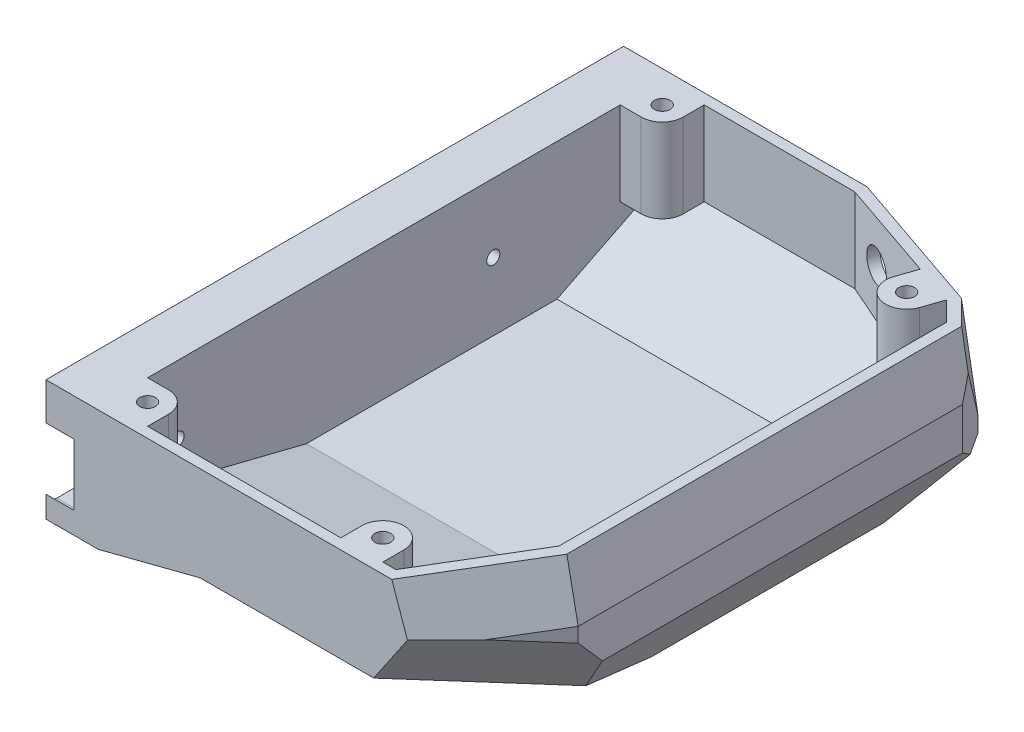
from build123d import *
from OCP.BRepFilletAPI import BRepFilletAPI_MakeChamfer

# Parameters (mm, degrees)
SKETCH1_W               = 55
SKETCH1_H               = 60
BOSS_EXTRUDE1_DEPTH     = 28
CHAMFER5_SIZE           = 15
CHAMFER5_SIZE2          = 9
CUT_EXTRUDE3_DEPTH      = 98.816154085
CUT_EXTRUDE5_DEPTH      = 98.816154085
CHAMFER2_SIZE           = 6
CHAMFER2_SIZE2          = 10
CHAMFER2_PART_2_SIZE    = 6
CHAMFER2_PART_2_SIZE2   = 10
CHAMFER3_SIZE           = 10
CHAMFER3_SIZE2          = 3
CHAMFER8_SIZE           = 3
CHAMFER8_SIZE2          = 4.688384964
CHAMFER8_SIZE2_2        = 4.826086957
SHELL1_T                = -2
SKETCH1_3_W             = 9.35
SKETCH1_3_H             = 100
SKETCH1_3_H_2           = 10
BOSS_EXTRUDE2_DEPTH     = 28
CUT_EXTRUDE1_DEPTH      = 5.3
CUT_EXTRUDE_THIN1_DEPTH = 5.3
SKETCH4_R               = 1.250001298
SKETCH4_R_2             = 1.250245712
CUT_EXTRUDE2_DEPTH      = 4.05
CUT_EXTRUDE4_DEPTH      = 9.35
CUT_EXTRUDE6_DEPTH      = 98.816154085
CHAMFER6_SIZE           = 20
CHAMFER6_SIZE_2         = 5
SKETCH10_R              = 3
CUT_EXTRUDE7_DEPTH      = 2
SKETCH12_R              = 1.5
BOSS_EXTRUDE3_DEPTH     = 18.45
SKETCH12_4_R            = 1.5
BOSS_EXTRUDE4_DEPTH     = 15.973931
SKETCH12_5_R            = 1.5
BOSS_EXTRUDE5_DEPTH     = 17.86762


with BuildPart() as part:
    # Sketch1 → Boss-Extrude1 (new body)
    # profile 1 of 2: a face of its own
    with BuildSketch(Plane(origin=(0, 0, 0), x_dir=(1, 0, 0), z_dir=(0, 1, 0))):
        Polygon((29.5, 50), (-7.5, 50), (-42.5, 38), (-42.5, -40), (-30.5, -60), (29.5, -60), (29.5, -50), align=None)
        Rectangle(SKETCH1_W, SKETCH1_H, mode=Mode.SUBTRACT)
    # profile 2 of 2: a face of its own
    with BuildSketch(Plane(origin=(0, 0, 0), x_dir=(1, 0, 0), z_dir=(0, 1, 0))):
        Rectangle(SKETCH1_W, SKETCH1_H)
    extrude(amount=BOSS_EXTRUDE1_DEPTH)

    # Chamfer5
    chamfer5_edges = [part.edges().sort_by_distance(p)[0] for p in [
        (-25, 0, -44),
    ]]
    chamfer5_side = [part.faces().sort_by_distance(p)[0] for p in [
        (-5.320816864, 0, 5.646903821),
    ]]
    chamfer(chamfer5_edges, length=CHAMFER5_SIZE, length2=CHAMFER5_SIZE2, reference=chamfer5_side[0])

    # Sketch6 → Cut-Extrude3 (cut, through all)
    with BuildSketch(Plane(origin=(29.5, 0, 0), x_dir=(0, 0, -1), z_dir=(1, 0, 0))):
        Polygon((28.599998808, 0.090000199), (38.599998808, 5.090000199), (50, 10.790000795), (50, 0), (28.41999841, 0), align=None)
    extrude(amount=-CUT_EXTRUDE3_DEPTH, mode=Mode.SUBTRACT)

    # Sketch8 → Cut-Extrude5 (cut, through all)
    with BuildSketch(Plane.ZY.offset(42.5)):
        Polygon((20, 0), (60, 10), (60, 0), align=None)
    extrude(amount=-CUT_EXTRUDE5_DEPTH, mode=Mode.SUBTRACT)

    # Chamfer2
    chamfer2_edges = [part.edges().sort_by_distance(p)[0] for p in [
        (-42.5, 0, -1.071428571),
    ]]
    chamfer2_side = [part.faces().sort_by_distance(p)[0] for p in [
        (-5.998960327, 0, -3.839335876),
    ]]
    chamfer(chamfer2_edges, length=CHAMFER2_SIZE, length2=CHAMFER2_SIZE2, reference=chamfer2_side[0])

    # Chamfer2 part 2
    chamfer2_part_2_edges = [part.edges().sort_by_distance(p)[0] for p in [
        (-36.5, 7.5, 50),
    ]]
    chamfer2_part_2_side = [part.faces().sort_by_distance(p)[0] for p in [
        (-5.108695652, 4.855072464, 39.420289855),
    ]]
    chamfer(chamfer2_part_2_edges, length=CHAMFER2_PART_2_SIZE, length2=CHAMFER2_PART_2_SIZE2, reference=chamfer2_part_2_side[0])

    # Chamfer3: one chamfer whose edges measure the first distance from different faces: ONE call of the kernel's chamfer builder (chamfer() names one face for all edges)
    chamfer3_edges_1 = [part.edges().sort_by_distance(p)[0] for p in [
        (-36.5, 28, 50),
    ]]
    chamfer3_side_1 = [part.faces().sort_by_distance(p)[0] for p in [
        (-36.986722145, 22.762198781, 49.188796426),
    ]]
    chamfer3_edges_2 = [part.edges().sort_by_distance(p)[0] for p in [
        (-42.5, 28, 1),
    ]]
    chamfer3_side_2 = [part.faces().sort_by_distance(p)[0] for p in [
        (-42.5, 19.062821539, 0.675718674),
    ]]
    chamfer3 = BRepFilletAPI_MakeChamfer(part.part.solid().wrapped)
    for e in chamfer3_edges_1:
        chamfer3.Add(CHAMFER3_SIZE, CHAMFER3_SIZE2, e.wrapped, chamfer3_side_1[0].wrapped)  # the first distance lies on this face
    for e in chamfer3_edges_2:
        chamfer3.Add(CHAMFER3_SIZE, CHAMFER3_SIZE2, e.wrapped, chamfer3_side_2[0].wrapped)  # the first distance lies on this face
    add(Compound.cast(chamfer3.Shape()), mode=Mode.REPLACE)

    # Chamfer8: one chamfer whose edges measure the first distance from different faces: ONE call of the kernel's chamfer builder (chamfer() names one face for all edges)
    chamfer8_edges_1 = [part.edges().sort_by_distance(p)[0] for p in [
        (-41, 23, -38.514285714),
    ]]
    chamfer8_side_1 = [part.faces().sort_by_distance(p)[0] for p in [
        (-40.999367405, 23.002108649, 0.534923115),
    ]]
    chamfer8_edges_2 = [part.edges().sort_by_distance(p)[0] for p in [
        (-42.5, 14, -38),
    ]]
    chamfer8_side_2 = [part.faces().sort_by_distance(p)[0] for p in [
        (-24.809989525, 18.489778037, -44.065146449),
    ]]
    chamfer8 = BRepFilletAPI_MakeChamfer(part.part.solid().wrapped)
    for e in chamfer8_edges_1:
        chamfer8.Add(CHAMFER8_SIZE, CHAMFER8_SIZE2, e.wrapped, chamfer8_side_1[0].wrapped)  # the first distance lies on this face
    for e in chamfer8_edges_2:
        chamfer8.Add(CHAMFER8_SIZE, CHAMFER8_SIZE2_2, e.wrapped, chamfer8_side_2[0].wrapped)  # the first distance lies on this face
    add(Compound.cast(chamfer8.Shape()), mode=Mode.REPLACE)

    # Shell1
    shell1_openings = [part.faces().sort_by_distance(p)[0] for p in [
        (-3.850715667, 28, 5.420818652),
        (29.5, 15.210219058, 3.998585691),
    ]]
    offset(amount=SHELL1_T, openings=shell1_openings, kind=Kind.INTERSECTION)

    # Sketch1<3> → Boss-Extrude2 (add)
    with BuildSketch(Plane(origin=(0, 0, 0), x_dir=(1, 0, 0), z_dir=(0, 1, 0))):
        with Locations((34.175, 0)):
            Rectangle(SKETCH1_3_W, SKETCH1_3_H)
        with Locations((34.175, -55)):
            Rectangle(SKETCH1_3_W, SKETCH1_3_H_2)
    extrude(amount=BOSS_EXTRUDE2_DEPTH)

    # Sketch3 → Cut-Extrude1 (cut)
    with BuildSketch(Plane(origin=(38.85, 0, 0), x_dir=(0, 0, -1), z_dir=(1, 0, 0))):
        Polygon((34.557366217, 22.490000211), (-57.938007116, 22.490000211), (-58.396836221, 22.438301563), (-58.832665384, 22.285797958), (-59.223634601, 22.040136716), (-59.550133944, 21.713636209), (-59.795801938, 21.322668447), (-59.948307872, 20.886838382), (-60, 20.4280002), (-60, 9.572000334), (-59.948307872, 9.113161916), (-59.795801938, 8.677331822), (-59.550133944, 8.286364468), (-59.223634601, 7.959863262), (-58.832665384, 7.714202719), (-58.396836221, 7.561698647), (-57.938007116, 7.51), (34.557366217, 7.51), (35.093864598, 7.56284138), (35.609745709, 7.719331512), (36.08518437, 7.973458709), (36.501909895, 8.315457123), (36.84390761, 8.732182065), (37.098034807, 9.207620377), (37.254525637, 9.723501371), (37.307366086, 10.259999985), (37.307366086, 19.740000226), (37.254525637, 20.276498578), (37.098034807, 20.79237963), (36.84390761, 21.267818379), (36.501909895, 21.684543903), (36.08518437, 22.026541618), (35.609745709, 22.280668931), (35.093864598, 22.437159762), align=None)
    extrude(amount=-CUT_EXTRUDE1_DEPTH, mode=Mode.SUBTRACT)

    # Sketch3<2> → Cut-Extrude-Thin1 (cut)
    with BuildSketch(Plane(origin=(38.85, 0, 0), x_dir=(0, 0, -1), z_dir=(1, 0, 0))):
        Polygon((-58.408032741, 22.487356385), (-58.854496816, 22.331131453), (-59.255006355, 22.079475653), (-59.589472678, 21.745008138), (-59.84113526, 21.344500303), (-59.997362817, 20.898034618), (-60.05, 20.430807788), (-60.05, 9.569192748), (-59.997362818, 9.101965682), (-59.841135257, 8.655499956), (-59.589472684, 8.254992553), (-59.255006355, 7.920524316), (-58.854496805, 7.668869226), (-58.408032765, 7.512643829), (-57.940815111, 7.46), (34.559822602, 7.46), (35.103666322, 7.513564845), (35.628972433, 7.672914008), (36.113097308, 7.931684081), (36.537436306, 8.279930722), (36.885682237, 8.704269129), (37.144452294, 9.188393617), (37.303802182, 9.713699658), (37.357366086, 10.257543645), (37.357366086, 19.742456567), (37.303802182, 20.286300291), (37.144452297, 20.811606381), (36.885682251, 21.295731292), (36.537436304, 21.720070312), (36.113097289, 22.068316255), (35.628972465, 22.32708642), (35.103666311, 22.486436306), (34.559822559, 22.540000211), (-57.940815111, 22.540000211), align=None)
        Polygon((-58.396836221, 22.438301563), (-58.832665384, 22.285797958), (-59.223634601, 22.040136716), (-59.550133944, 21.713636209), (-59.795801938, 21.322668447), (-59.948307872, 20.886838382), (-60, 20.4280002), (-60, 9.572000334), (-59.948307872, 9.113161916), (-59.795801938, 8.677331822), (-59.550133944, 8.286364468), (-59.223634601, 7.959863262), (-58.832665384, 7.714202719), (-58.396836221, 7.561698647), (-57.938007116, 7.51), (34.557366217, 7.51), (35.093864598, 7.56284138), (35.609745709, 7.719331512), (36.08518437, 7.973458709), (36.501909895, 8.315457123), (36.84390761, 8.732182065), (37.098034807, 9.207620377), (37.254525637, 9.723501371), (37.307366086, 10.259999985), (37.307366086, 19.740000226), (37.254525637, 20.276498578), (37.098034807, 20.79237963), (36.84390761, 21.267818379), (36.501909895, 21.684543903), (36.08518437, 22.026541618), (35.609745709, 22.280668931), (35.093864598, 22.437159762), (34.557366217, 22.490000211), (-57.938007116, 22.490000211), align=None, mode=Mode.SUBTRACT)
    extrude(amount=-CUT_EXTRUDE_THIN1_DEPTH, mode=Mode.SUBTRACT)

    # Sketch4 → Cut-Extrude2 (cut)
    with BuildSketch(Plane(origin=(33.55, 0, 0), x_dir=(0, 0, -1), z_dir=(1, 0, 0))):
        with Locations((-44.274877957, 14.986979658)):
            Circle(SKETCH4_R)
        with Locations((15.829750418, 14.92958888)):
            Circle(SKETCH4_R_2)
    extrude(amount=-CUT_EXTRUDE2_DEPTH, mode=Mode.SUBTRACT)

    # Sketch7 → Cut-Extrude4 (cut)
    with BuildSketch(Plane.ZY.offset(-29.5)):
        Polygon((-28.41999841, 0), (-50, 10.790000795), (-50, 0), align=None)
    extrude(amount=-CUT_EXTRUDE4_DEPTH, mode=Mode.SUBTRACT)

    # Sketch9 → Cut-Extrude6 (cut, through all)
    with BuildSketch(Plane.ZY.offset(-29.5)):
        Polygon((60, 0), (60, 5), (35, 0), align=None)
    extrude(amount=-CUT_EXTRUDE6_DEPTH, mode=Mode.SUBTRACT)

    # Chamfer6
    # the kernel refuses this chamfer: 20, 5 mm, written as the material it adds along each edge
    with BuildSketch(Plane(origin=(29.5, -12.597918829, -30.391675317), x_dir=(-0.9999563942249224, 0.009059783074481399, -0.0022649457686203496), z_dir=(0, 0.24253562503633297, 0.9701425001453319))) as chamfer6_piece_1_section:
        Polygon((CHAMFER6_SIZE * 0.999956394225, CHAMFER6_SIZE * 0.00933861064032), (-CHAMFER6_SIZE_2 * 0.00933861064032, CHAMFER6_SIZE_2 * 0.999956394225), (0, 0), align=None)
    chamfer6_piece_1 = extrude(amount=145.116156247, mode=Mode.PRIVATE)
    chamfer6_piece_1 = split(chamfer6_piece_1, bisect_by=Plane(origin=(21.891274925, 0, 42.504406507), z_dir=(0, 1, 0)), keep=Keep.TOP, mode=Mode.PRIVATE)
    chamfer6_piece_1 = split(chamfer6_piece_1, bisect_by=Plane(origin=(21.891274925, 4.42094487, 60), z_dir=(0, 0, -1)), keep=Keep.TOP, mode=Mode.PRIVATE)
    chamfer6_piece_1 = split(chamfer6_piece_1, bisect_by=Plane(origin=(21.891274925, 1.613191439, 43.065957193), z_dir=(0, 0.9805806756909202, -0.19611613513818396)), keep=Keep.TOP, mode=Mode.PRIVATE)
    add(chamfer6_piece_1)

    # Sketch10 → Cut-Extrude7 (cut)
    with BuildSketch(Plane(origin=(-16.128560993, 0, -47.041636231), x_dir=(-0.9459459459459459, 0, 0.3243243243243241), z_dir=(-0.3243243243243242, 0, -0.945945945945946))):
        with Locations((-2.121621622, 20)):
            Circle(SKETCH10_R)
    extrude(amount=-CUT_EXTRUDE7_DEPTH, mode=Mode.SUBTRACT)

    # Sketch12 → Boss-Extrude3 (add)
    # profile 1 of 2: a face of its own
    with BuildSketch(Plane(origin=(0, 28, 0), x_dir=(1, 0, 0), z_dir=(0, 1, 0))):
        with BuildLine():
            Line((21.5, -58), (29.5, -58))
            Line((29.5, -58), (29.5, -50))
            Line((29.5, -50), (25.5, -50))
            ThreePointArc((25.5, -50), (22.671572875, -51.171572875), (21.5, -54))
            Line((21.5, -54), (21.5, -58))
        make_face()
        with Locations(Location((25.5, -54, 0), (0, 0, 270))):
            Circle(SKETCH12_R, mode=Mode.SUBTRACT)
    # profile 2 of 2: a face of its own
    with BuildSketch(Plane(origin=(0, 28, 0), x_dir=(1, 0, 0), z_dir=(0, 1, 0))):
        with BuildLine():
            Line((-23.291144984, -58), (-15.291144984, -58))
            Line((-15.291144984, -58), (-15.291144984, -54))
            ThreePointArc((-15.291144984, -54), (-19.291144984, -50), (-23.291144984, -54))
            Line((-23.291144984, -54), (-23.291144984, -58))
        make_face()
        with Locations(Location((-19.291144984, -54, 0), (0, 0, 270))):
            Circle(SKETCH12_R, mode=Mode.SUBTRACT)
    extrude(amount=-BOSS_EXTRUDE3_DEPTH)

    # Sketch12<4> → Boss-Extrude4 (add)
    with BuildSketch(Plane(origin=(0, 28, 0), x_dir=(1, 0, 0), z_dir=(0, 1, 0))):
        with BuildLine():
            Line((29.5, 40), (29.5, 48))
            Line((29.5, 48), (21.5, 48))
            Line((21.5, 48), (21.5, 44))
            ThreePointArc((21.5, 44), (22.671572875, 41.171572875), (25.5, 40))
            Line((25.5, 40), (29.5, 40))
        make_face()
        with Locations(Location((25.5, 44, 0), (0, 0, 270))):
            Circle(SKETCH12_4_R, mode=Mode.SUBTRACT)
    extrude(amount=-BOSS_EXTRUDE4_DEPTH)

    # Sketch12<5> → Boss-Extrude5 (add)
    with BuildSketch(Plane(origin=(0, 28, 0), x_dir=(1, 0, 0), z_dir=(0, 1, 0))):
        with BuildLine():
            Line((-26.156435162, 41.48922223), (-33.72400273, 38.894627636))
            Line((-33.72400273, 38.894627636), (-32.426705432, 35.110843852))
            ThreePointArc((-32.426705432, 35.110843852), (-30.401133137, 32.815274277), (-27.34562442, 32.624357342))
            ThreePointArc((-27.34562442, 32.624357342), (-25.050054776, 34.649929661), (-24.859137865, 37.705438446))
            Line((-24.859137865, 37.705438446), (-26.156435162, 41.48922223))
        make_face()
        with Locations(Location((-28.642921649, 36.408141149, 0), (0, 0, 270))):
            Circle(SKETCH12_5_R, mode=Mode.SUBTRACT)
    extrude(amount=-BOSS_EXTRUDE5_DEPTH)


with BuildPart() as body_2:
    # Mirror1: mirrored copy
    add(part.part.mirror(Plane(origin=(48.85, 0, 0), x_dir=(0, 0, 1), z_dir=(1, 0, 0))))


solid = body_2.part
